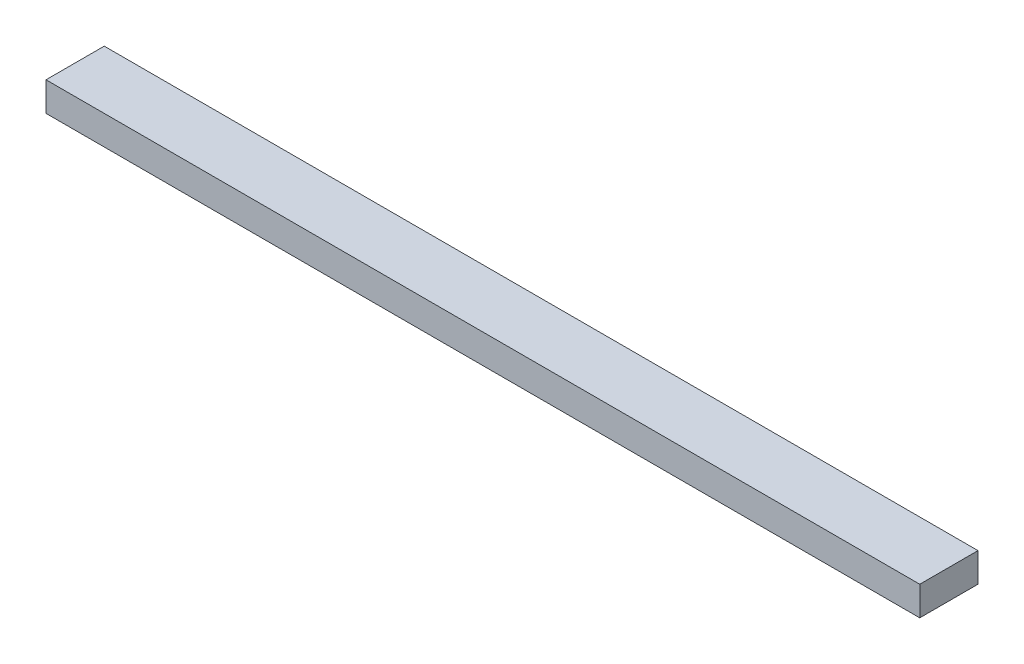
from build123d import *

# Parameters (mm, degrees)
SKETCH1_W           = 190.5
SKETCH1_H           = 6.35
BOSS_EXTRUDE1_DEPTH = 12.7


with BuildPart() as part:
    # Sketch1 → Boss-Extrude1 (new body)
    with BuildSketch(Plane.XY):
        with Locations((-30.030526088, -11.1125)):
            Rectangle(SKETCH1_W, SKETCH1_H)
    extrude(amount=BOSS_EXTRUDE1_DEPTH)


solid = part.part
